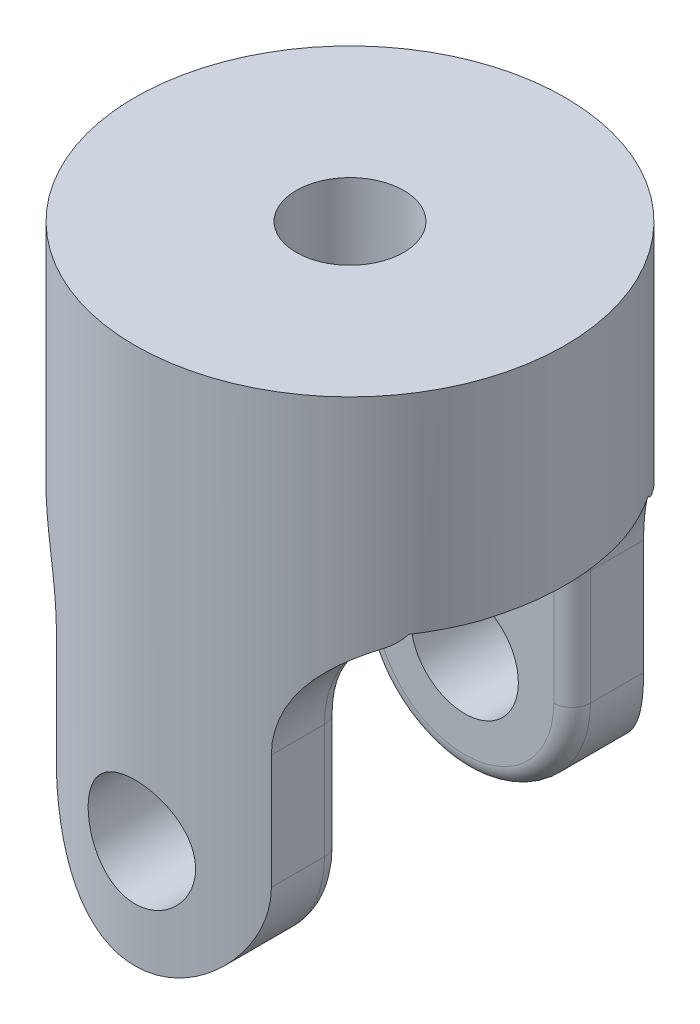
from build123d import *

# Parameters (mm, degrees)
SKETCH1_R               = 19.05
BASE_EXTRUDE_DEPTH      = 47.625
CUT_EXTRUDE1_DEPTH      = 55.716959208
CUT_EXTRUDE1_DEPTH_BACK = 55.716959208
CUT_EXTRUDE5_DEPTH      = 55.716959365
CUT_EXTRUDE5_DEPTH_BACK = 55.716959365
FILLET1_R               = 1.6256
CUT_EXTRUDE6_DEPTH      = 55.716959365
CUT_EXTRUDE6_DEPTH_BACK = 55.716959365
SKETCH11_R              = 4.7625
SKETCH12_R              = 4.7625
CUT_EXTRUDE7_DEPTH      = 55.716959365


with BuildPart() as part:
    # Sketch1 → Base-Extrude (new body)
    with BuildSketch(Plane(origin=(0, 0, 0), x_dir=(-1, 0, 0), z_dir=(0, 1, 0))):
        with Locations(Location((0, 0, 0), (0, 0, 90))):
            Circle(SKETCH1_R)
    extrude(amount=BASE_EXTRUDE_DEPTH)

    # Sketch2 → Cut-Extrude1 (cut, two sides: drawn at the far end of the back side and taken through both)
    with BuildSketch(Plane.XY.offset(-CUT_EXTRUDE1_DEPTH_BACK)):
        with BuildLine():
            Line((-19.05, -131.979516723), (-19.05, 0))
            Line((-19.05, 0), (-19.05, 29.21))
            ThreePointArc((-19.05, 29.21), (-12.314807909, 26.420192091), (-9.525, 19.685))
            Line((-9.525, 19.685), (-9.525, 9.525))
            ThreePointArc((-9.525, 9.525), (0, 0), (9.525, 9.525))
            Line((9.525, 9.525), (9.525, 19.685))
            ThreePointArc((9.525, 19.685), (12.314807909, 26.420192091), (19.05, 29.21))
            Line((19.05, 29.21), (19.05, 0))
            Line((19.05, 0), (19.05, -131.979516723))
            Line((19.05, -131.979516723), (19.05, -395.938550169))
            Line((19.05, -395.938550169), (-19.05, -395.938550169))
            Line((-19.05, -395.938550169), (-19.05, -131.979516723))
        make_face()
    extrude(amount=CUT_EXTRUDE1_DEPTH + CUT_EXTRUDE1_DEPTH_BACK, mode=Mode.SUBTRACT)

    # Sketch8 → Cut-Extrude5 (cut, two sides: drawn at the far end of the back side and taken through both)
    with BuildSketch(Plane(origin=(0, 0, 0), x_dir=(0, 0, -1), z_dir=(1, 0, 0)).offset(-CUT_EXTRUDE5_DEPTH_BACK)):
        Polygon((-10.16, -121.738350451), (-10.16, 0), (-10.16, 29.145238826), (10.16, 29.145238826), (10.16, 0), (10.16, -121.738350451), (10.16, -365.215051352), (-10.16, -365.215051352), align=None)
    extrude(amount=CUT_EXTRUDE5_DEPTH + CUT_EXTRUDE5_DEPTH_BACK, mode=Mode.SUBTRACT)

    # Fillet1
    # the kernel refuses this fillet: 1.6256 mm, written as the material it takes off along each edge
    with BuildSketch(Plane(origin=(0, 9.525, -10.16), x_dir=(1, 0, 0), z_dir=(0, 1, 0))) as fillet1_piece_1:
        with BuildLine():
            CenterArc((9.525 - FILLET1_R, FILLET1_R), FILLET1_R, 270, 90)
            Line((9.525, FILLET1_R), (9.525, 0))
            Line((9.525, 0), (9.525 - FILLET1_R, 0))
        make_face()
    revolve(axis=Axis((0, 9.525, -10.16), (0, 0, -1)), revolution_arc=180, mode=Mode.SUBTRACT)
    with BuildSketch(Plane(origin=(0, 9.525, 10.16), x_dir=(1, 0, 0), z_dir=(0, 1, 0))) as fillet1_piece_2:
        with BuildLine():
            CenterArc((9.525 - FILLET1_R, -FILLET1_R), FILLET1_R, 0, 90)
            Line((9.525 - FILLET1_R, 0), (9.525, 0))
            Line((9.525, 0), (9.525, -FILLET1_R))
        make_face()
    revolve(axis=Axis((0, 9.525, 10.16), (0, 0, -1)), revolution_arc=180, mode=Mode.SUBTRACT)
    with BuildSketch(Plane(origin=(-9.525, 19.685, 10.16), x_dir=(1, 0, 0), z_dir=(0, -1, 0)), Plane(origin=(-9.525, 9.525, -10.16), x_dir=(1, 0, 0), z_dir=(0, 1, 0)), Plane(origin=(9.525, 19.685, -10.16), x_dir=(-1, 0, 0), z_dir=(0, -1, 0))) as fillet1_piece_3:
        with BuildLine():
            CenterArc((FILLET1_R, FILLET1_R), FILLET1_R, 180, 90)
            Line((0, FILLET1_R), (0, 0))
            Line((0, 0), (FILLET1_R, 0))
        make_face()
    extrude(amount=10.16, mode=Mode.SUBTRACT)
    with BuildSketch(Plane(origin=(-19.05, 19.685, 10.16), x_dir=(-0.11324357252036664, 0.9935672565472476, 0), z_dir=(-0.9935672565472476, -0.11324357252036664, 0))) as fillet1_piece_4_section:
        with BuildLine():
            CenterArc((9.525 + FILLET1_R, -FILLET1_R), FILLET1_R, 90, 90)
            Line((9.525, -FILLET1_R), (9.525, 0))
            Line((9.525, 0), (9.525 + FILLET1_R, 0))
        make_face()
    fillet1_piece_4 = revolve(axis=Axis((-19.05, 19.685, 10.16), (0, 0, -1)), revolution_arc=96.502327352, mode=Mode.PRIVATE)
    fillet1_piece_4 = split(fillet1_piece_4, bisect_by=Plane(origin=(-10.921305304, 29.145238826, 10.623714101), z_dir=(0, -1, 0)), keep=Keep.TOP, mode=Mode.PRIVATE)
    add(fillet1_piece_4, mode=Mode.SUBTRACT)
    with BuildSketch(Plane(origin=(-19.05, 19.685, -10.16), x_dir=(-0.11324357231306123, 0.9935672565708757, 0), z_dir=(-0.9935672565708757, -0.11324357231306123, 0))) as fillet1_piece_5_section:
        with BuildLine():
            CenterArc((9.525 + FILLET1_R, FILLET1_R), FILLET1_R, 180, 90)
            Line((9.525, FILLET1_R), (9.525, 0))
            Line((9.525, 0), (9.525 + FILLET1_R, 0))
        make_face()
    fillet1_piece_5 = revolve(axis=Axis((-19.05, 19.685, -10.16), (0, 0, -1)), revolution_arc=96.50232734, mode=Mode.PRIVATE)
    fillet1_piece_5 = split(fillet1_piece_5, bisect_by=Plane(origin=(-10.921305752, 29.145238826, -10.62371355), z_dir=(0, -1, 0)), keep=Keep.TOP, mode=Mode.PRIVATE)
    add(fillet1_piece_5, mode=Mode.SUBTRACT)
    with BuildSketch(Plane(origin=(19.05, 19.685, 10.16), x_dir=(-1, 0, 0), z_dir=(0, -1, 0))) as fillet1_piece_6_section:
        with BuildLine():
            CenterArc((9.525 + FILLET1_R, -FILLET1_R), FILLET1_R, 90, 90)
            Line((9.525 + FILLET1_R, 0), (9.525, 0))
            Line((9.525, 0), (9.525, -FILLET1_R))
        make_face()
    fillet1_piece_6 = revolve(axis=Axis((19.05, 19.685, 10.16), (0, 0, -1)), revolution_arc=96.50232734, mode=Mode.PRIVATE)
    fillet1_piece_6 = split(fillet1_piece_6, bisect_by=Plane(origin=(10.921305304, 29.145238826, 10.623714101), z_dir=(0, -1, 0)), keep=Keep.TOP, mode=Mode.PRIVATE)
    add(fillet1_piece_6, mode=Mode.SUBTRACT)
    with BuildSketch(Plane(origin=(9.525, 9.525, 10.16), x_dir=(0, 0, 1), z_dir=(0, 1, 0))) as fillet1_piece_7:
        with BuildLine():
            CenterArc((FILLET1_R, -FILLET1_R), FILLET1_R, 90, 90)
            Line((0, -FILLET1_R), (0, 0))
            Line((0, 0), (FILLET1_R, 0))
        make_face()
    extrude(amount=10.16, mode=Mode.SUBTRACT)
    with BuildSketch(Plane(origin=(19.05, 19.685, -10.16), x_dir=(-1, 0, 0), z_dir=(0, -1, 0))) as fillet1_piece_8_section:
        with BuildLine():
            CenterArc((9.525 + FILLET1_R, FILLET1_R), FILLET1_R, 180, 90)
            Line((9.525, FILLET1_R), (9.525, 0))
            Line((9.525, 0), (9.525 + FILLET1_R, 0))
        make_face()
    fillet1_piece_8 = revolve(axis=Axis((19.05, 19.685, -10.16), (0, 0, -1)), revolution_arc=96.502327352, mode=Mode.PRIVATE)
    fillet1_piece_8 = split(fillet1_piece_8, bisect_by=Plane(origin=(9.18555454, 29.145238826, -10.429133474), z_dir=(0, -1, 0)), keep=Keep.TOP, mode=Mode.PRIVATE)
    add(fillet1_piece_8, mode=Mode.SUBTRACT)

    # Sketch11 → Cut-Extrude6 (cut, two sides: drawn at the far end of the back side and taken through both)
    with BuildSketch(Plane.XY.offset(-CUT_EXTRUDE6_DEPTH_BACK)):
        with Locations(Location((0, 9.525, 0), (0, 0, 90))):
            Circle(SKETCH11_R)
    extrude(amount=CUT_EXTRUDE6_DEPTH + CUT_EXTRUDE6_DEPTH_BACK, mode=Mode.SUBTRACT)

    # Sketch12 → Cut-Extrude7 (cut, through all)
    with BuildSketch(Plane(origin=(0, 47.625, 0), x_dir=(-1, 0, 0), z_dir=(0, 1, 0))):
        with Locations(Location((0, 0, 0), (0, 0, 90))):
            Circle(SKETCH12_R)
    extrude(amount=-CUT_EXTRUDE7_DEPTH, mode=Mode.SUBTRACT)


solid = part.part
